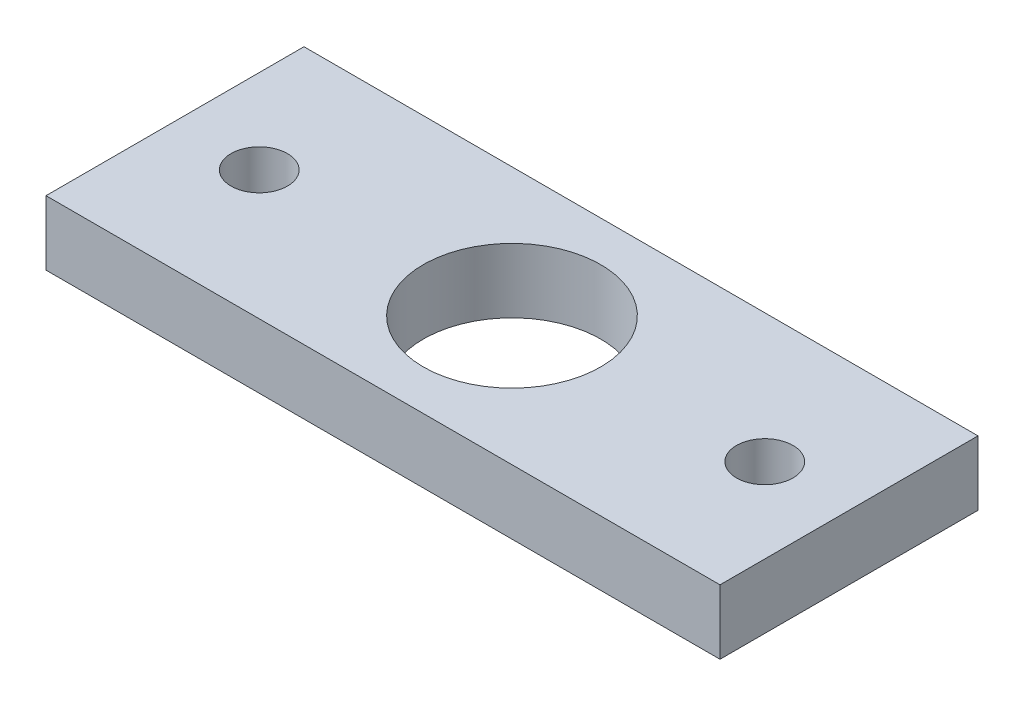
from build123d import *

# Parameters (mm, degrees)
SKETCH1_W           = 41.8
SKETCH1_H           = 16
SKETCH1_R           = 1.75
SKETCH1_R_2         = 5.5
BOSS_EXTRUDE1_DEPTH = 4


with BuildPart() as part:
    # Sketch1 → Boss-Extrude1 (new body)
    with BuildSketch(Plane(origin=(0, 0, 0), x_dir=(1, 0, 0), z_dir=(0, 1, 0))):
        Rectangle(SKETCH1_W, SKETCH1_H)
        with Locations((-15.675, 0)):
            Circle(SKETCH1_R, mode=Mode.SUBTRACT)
        Circle(SKETCH1_R_2, mode=Mode.SUBTRACT)
        with Locations((15.675, 0)):
            Circle(SKETCH1_R, mode=Mode.SUBTRACT)
    extrude(amount=BOSS_EXTRUDE1_DEPTH)


solid = part.part
